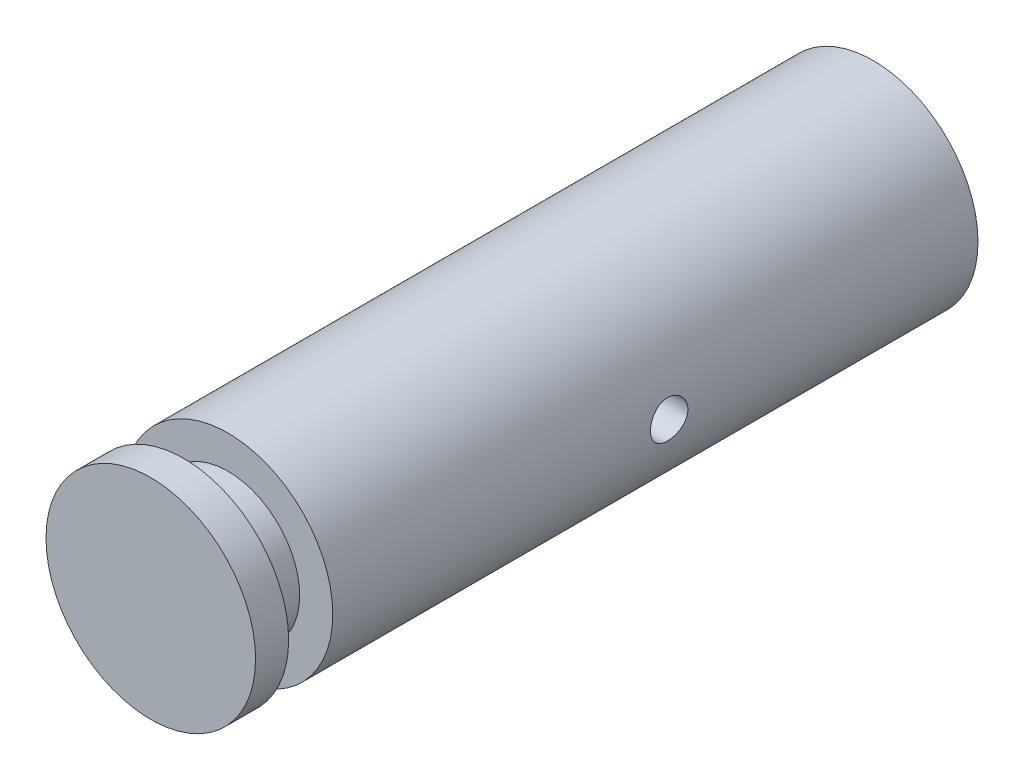
from build123d import *

# Parameters (mm, degrees)
AUFSATZ_LINEAR_AUSTRAGEN1_DEPTH      = 75
AUFSATZ_LINEAR_AUSTRAGEN1_DEPTH_BACK = 56
SKIZZE1_R                            = 19
SKIZZE2_W                            = 8
SKIZZE2_H                            = 6
M8_GEWINDEBOHRUNG1_D                 = 6.8
M8_GEWINDEBOHRUNG1_DEPTH             = 65
M8_GEWINDEBOHRUNG1_TIP               = 2.042926105
SKIZZE7_W                            = 3.4
SKIZZE7_H                            = 19


with BuildPart() as part:
    # Skizze1 → Aufsatz-Linear austragen1 (new, two sides: drawn at the far end of the back side and taken through both)
    with BuildSketch(Plane.XY.offset(-AUFSATZ_LINEAR_AUSTRAGEN1_DEPTH_BACK)):
        Circle(SKIZZE1_R)
    extrude(amount=AUFSATZ_LINEAR_AUSTRAGEN1_DEPTH + AUFSATZ_LINEAR_AUSTRAGEN1_DEPTH_BACK)

    # Skizze2 → Schnitt-Rotation1 (revolve, cut)
    with BuildSketch(Plane(origin=(0, 0, 0), x_dir=(0, 0, -1), z_dir=(1, 0, 0))):
        with Locations((-65, 16)):
            Rectangle(SKIZZE2_W, SKIZZE2_H)
    revolve(axis=Axis((0, 0, 61.5), (0, 0, -1)), mode=Mode.SUBTRACT)

    # M8 Gewindebohrung1
    with Locations(Plane(origin=(0, 0, -56), x_dir=(-1, 0, 0), z_dir=(0, 0, -1))):
        with Locations((0, 0)):
            Hole(M8_GEWINDEBOHRUNG1_D / 2, depth=M8_GEWINDEBOHRUNG1_DEPTH)
            with Locations((0, 0, -(M8_GEWINDEBOHRUNG1_DEPTH + M8_GEWINDEBOHRUNG1_TIP / 2))):  # 118° drill point
                Cone(0, M8_GEWINDEBOHRUNG1_D / 2, M8_GEWINDEBOHRUNG1_TIP, mode=Mode.SUBTRACT)

    # Skizze7 → Kernloch für M8 Gewinde1 (revolve, cut)
    with BuildSketch(Plane.ZX):
        with Locations((1.7, 9.5)):
            Rectangle(SKIZZE7_W, SKIZZE7_H)
    kernloch_f_r_m8_gewinde1 = revolve(axis=Axis((-6.35, 0, 0), (1, 0, 0)), mode=Mode.SUBTRACT)

    # Spiegeln1: Kernloch für M8 Gewinde1 across plane
    add(kernloch_f_r_m8_gewinde1.mirror(Plane(origin=(0, 0, 0), x_dir=(0, 0, 1), z_dir=(1, 0, 0))), mode=Mode.SUBTRACT)


solid = part.part
